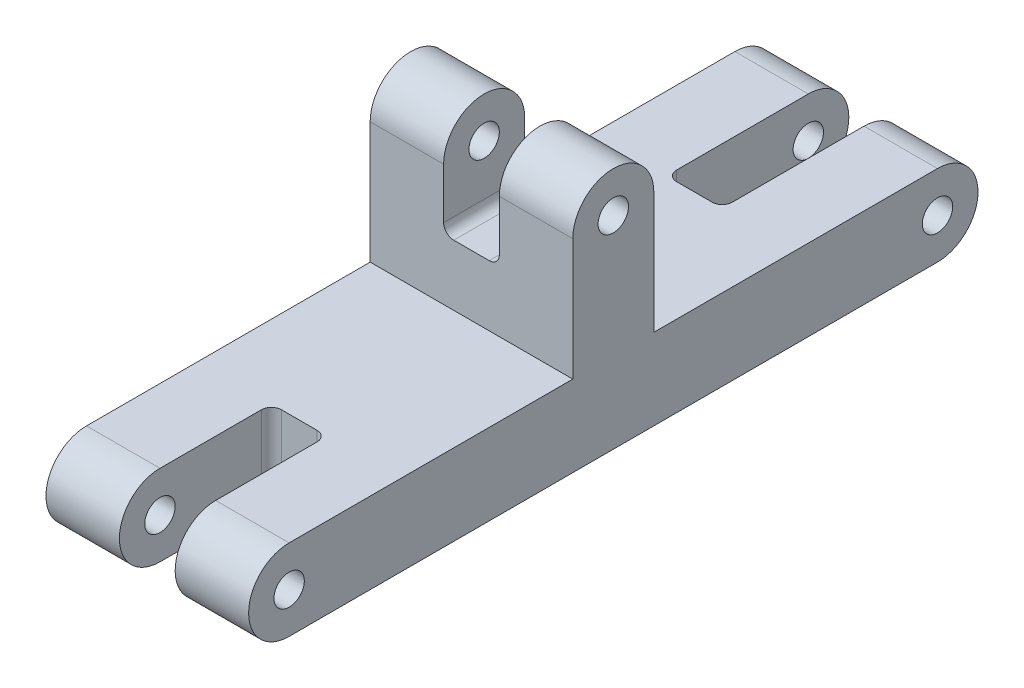
from build123d import *

# Parameters (mm, degrees)
CROQUIS1_R              = 1.5
SALIENTE_EXTRUIR1_DEPTH = 10
CROQUIS2_W              = 8
CROQUIS2_H              = 10
CROQUIS2_W_2            = 18
CROQUIS2_H_2            = 8
CROQUIS2_W_3            = 15
CORTAR_EXTRUIR1_DEPTH   = 2.75
REDONDEO1_R             = 1


with BuildPart() as part:
    # Croquis1 → Saliente-Extruir1 (new, symmetric)
    with BuildSketch(Plane(origin=(0, 0, 0), x_dir=(0, 0, -1), z_dir=(1, 0, 0))):
        with BuildLine():
            Line((-15, -4), (15, -4))
            ThreePointArc((15, -4), (19, 0), (15, 4))
            Line((15, 4), (-13, 4))
            Line((-13, 4), (-13, 16))
            ThreePointArc((-13, 16), (-17, 20), (-21, 16))
            Line((-21, 16), (-21, 4))
            Line((-21, 4), (-49, 4))
            ThreePointArc((-49, 4), (-53, 0), (-49, -4))
            Line((-49, -4), (-15, -4))
        make_face()
        with Locations((15, 0)):
            Circle(CROQUIS1_R, mode=Mode.SUBTRACT)
        with Locations((-17, 16)):
            Circle(CROQUIS1_R, mode=Mode.SUBTRACT)
        with Locations((-49, 0)):
            Circle(CROQUIS1_R, mode=Mode.SUBTRACT)
    extrude(amount=SALIENTE_EXTRUIR1_DEPTH, both=True)

    # Croquis2 → Cortar-Extruir1 (cut, symmetric)
    with BuildSketch(Plane(origin=(0, 0, 0), x_dir=(0, 0, -1), z_dir=(1, 0, 0))):
        with Locations((-17, 15)):
            Rectangle(CROQUIS2_W, CROQUIS2_H)
        with Locations((10, 0)):
            Rectangle(CROQUIS2_W_2, CROQUIS2_H_2)
        with Locations((-45.5, 0)):
            Rectangle(CROQUIS2_W_3, CROQUIS2_H_2)
    extrude(amount=CORTAR_EXTRUIR1_DEPTH, both=True, mode=Mode.SUBTRACT)

    # Redondeo1
    redondeo1_edges = [part.edges().sort_by_distance(p)[0] for p in [
        (2.75, 0, 38),
        (-2.75, 0, 38),
        (2.75, 0, -1),
        (-2.75, 0, -1),
        (2.75, 10, 17),
        (-2.75, 10, 17),
    ]]
    fillet(redondeo1_edges, radius=REDONDEO1_R)


solid = part.part
